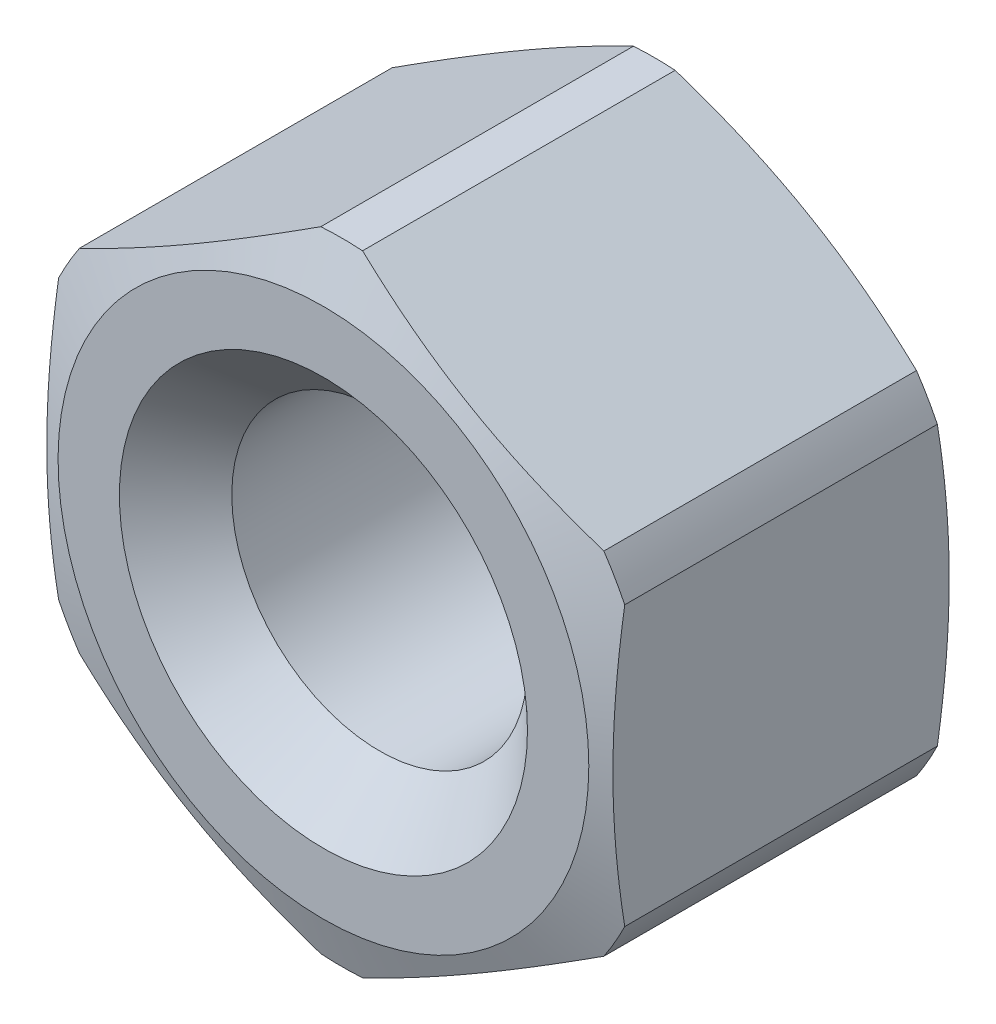
from build123d import *

# Parameters (mm, degrees)
SKETCH_2_OUTSIDE_W  = 36.874
SKETCH_2_OUTSIDE_H  = 36.874
CUT_EXTRUDE_1_DEPTH = 25.017103281


with BuildPart() as part:
    # Эскиз1 → Повернуть1 (revolve)
    with BuildSketch(Plane(origin=(0, 0, 0), x_dir=(0, 0, -1), z_dir=(1, 0, 0))):
        Polygon((-5.017949192, 6.267949192), (5.017949192, 6.267949192), (7.4, 8.65), (7.4, 11.25), (6.626563252, 13.375), (-6.626563252, 13.375), (-7.4, 11.25), (-7.4, 8.65), align=None)
    revolve(axis=Axis((0, 0, 152.740188543), (0, 0, -1)))

    # Эскиз2 outside → Вырез-Вытянуть1 (cut, through all)
    with BuildSketch(Plane.XY.offset(7.4)):
        Rectangle(SKETCH_2_OUTSIDE_W, SKETCH_2_OUTSIDE_H)
        Polygon((0, -13.856406461), (12, -6.92820323), (12, 6.92820323), (0, 13.856406461), (-12, 6.92820323), (-12, -6.92820323), align=None, mode=Mode.SUBTRACT)
    extrude(amount=-CUT_EXTRUDE_1_DEPTH, mode=Mode.SUBTRACT)


solid = part.part
